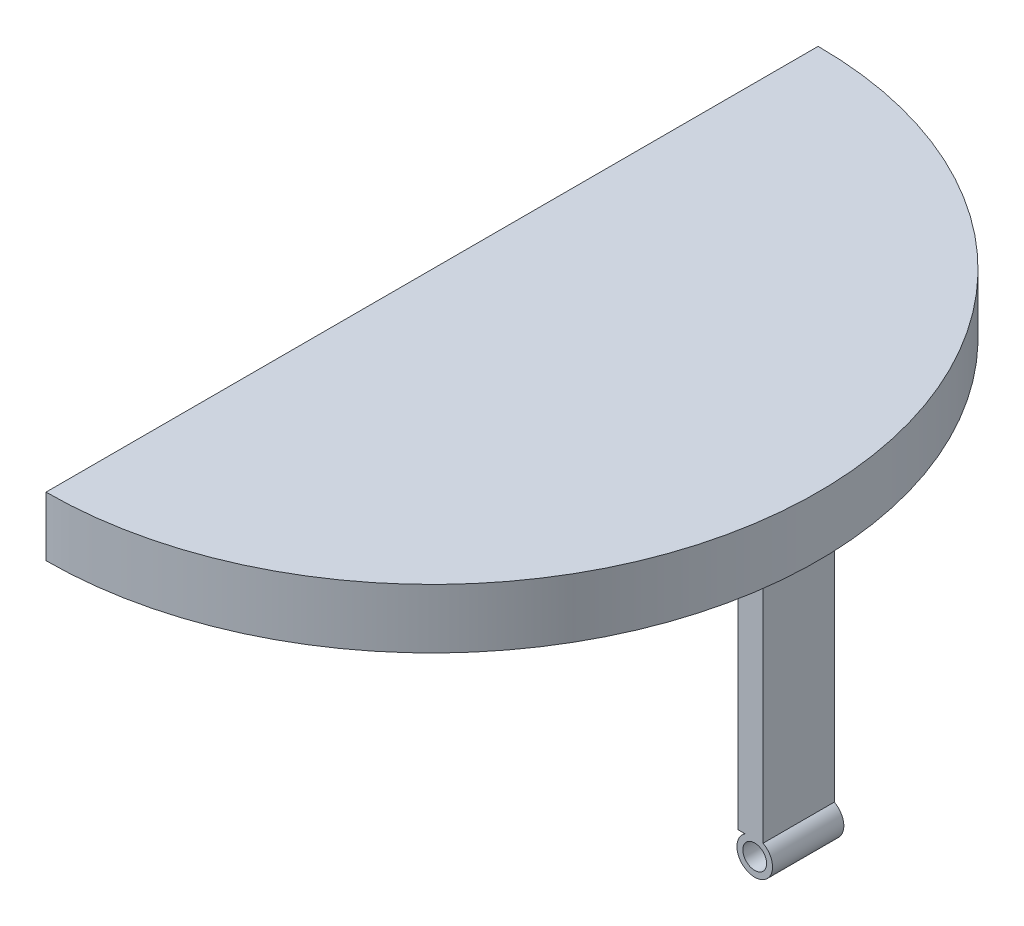
from build123d import *

# Parameters (mm, degrees)
AUFSATZ_LINEAR_AUSTRAGEN1_DEPTH = 5
SKIZZE3_W                       = 2.117867818
SKIZZE3_H                       = 6
AUFSATZ_LINEAR_AUSTRAGEN2_DEPTH = 20
SKIZZE5_R                       = 1.5
AUFSATZ_LINEAR_AUSTRAGEN4_DEPTH = 6
SKIZZE7_R                       = 1
SCHNITT_LINEAR_AUSTRAGEN2_DEPTH = 6


with BuildPart() as part:
    # Skizze1 → Aufsatz-Linear austragen1 (new body)
    with BuildSketch(Plane(origin=(0, 0, 0), x_dir=(1, 0, 0), z_dir=(0, 1, 0))):
        with BuildLine():
            Line((0, 0), (0, -65))
            ThreePointArc((0, -65), (32.5, -32.5), (0, 0))
        make_face()
    extrude(amount=AUFSATZ_LINEAR_AUSTRAGEN1_DEPTH)

    # Skizze3 → Aufsatz-Linear austragen2 (add)
    with BuildSketch(Plane.XZ):
        with Locations((29.782013558, 32.482228615)):
            Rectangle(SKIZZE3_W, SKIZZE3_H)
    extrude(amount=AUFSATZ_LINEAR_AUSTRAGEN2_DEPTH)

    # Skizze5 → Aufsatz-Linear austragen4 (add)
    with BuildSketch(Plane(origin=(0, 0.692290062, 29.482228615), x_dir=(-1, 0, 0), z_dir=(0, 0, -1))):
        with Locations((-30.143686409, -21.957862138)):
            Circle(SKIZZE5_R)
    extrude(amount=-AUFSATZ_LINEAR_AUSTRAGEN4_DEPTH)

    # Skizze7 → Schnitt-Linear austragen2 (cut)
    with BuildSketch(Plane(origin=(0, 0, 29.482228615), x_dir=(-1, 0, 0), z_dir=(0, 0, -1))):
        with Locations((-30.143811344, -21.265492581)):
            Circle(SKIZZE7_R)
    extrude(amount=-SCHNITT_LINEAR_AUSTRAGEN2_DEPTH, mode=Mode.SUBTRACT)


solid = part.part
